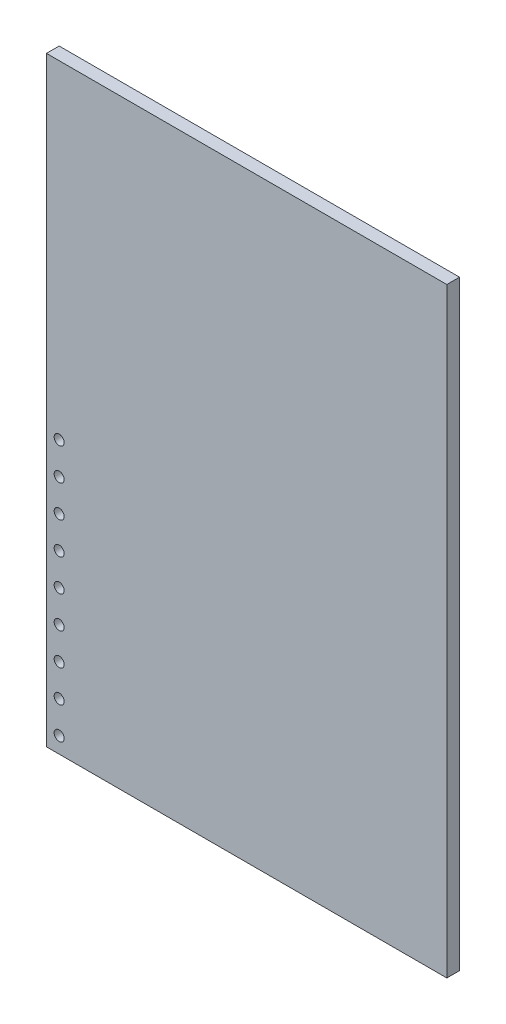
from build123d import *

# Parameters (mm, degrees)
SKETCH1_W           = 100
SKETCH1_H           = 3.175
BOSS_EXTRUDE1_DEPTH = 150
SKETCH2_R           = 1.25
CUT_EXTRUDE2_DEPTH  = 5
SKETCH2_14_R        = 1.25
CUT_EXTRUDE3_DEPTH  = 5
SKETCH2_15_R        = 1.25
CUT_EXTRUDE4_DEPTH  = 5
SKETCH2_16_R        = 1.25
CUT_EXTRUDE5_DEPTH  = 5
SKETCH2_17_R        = 1.25
CUT_EXTRUDE6_DEPTH  = 5
SKETCH2_18_R        = 1.25
CUT_EXTRUDE7_DEPTH  = 5
SKETCH2_19_R        = 1.25
CUT_EXTRUDE8_DEPTH  = 5
SKETCH2_20_R        = 1.25
CUT_EXTRUDE9_DEPTH  = 5
SKETCH2_21_R        = 1.25
CUT_EXTRUDE10_DEPTH = 5


with BuildPart() as part:
    # Sketch1 → Boss-Extrude1 (new body)
    with BuildSketch(Plane(origin=(0, 0, 0), x_dir=(1, 0, 0), z_dir=(0, 1, 0))):
        with Locations((50, 1.5875)):
            Rectangle(SKETCH1_W, SKETCH1_H)
    extrude(amount=BOSS_EXTRUDE1_DEPTH)

    # Sketch2 → Cut-Extrude2 (cut)
    with BuildSketch(Plane.XY):
        with Locations((3.175, 68)):
            Circle(SKETCH2_R)
    extrude(amount=-CUT_EXTRUDE2_DEPTH, mode=Mode.SUBTRACT)

    # Sketch2<14> → Cut-Extrude3 (cut)
    with BuildSketch(Plane.XY):
        with Locations((3.175, 60)):
            Circle(SKETCH2_14_R)
    extrude(amount=-CUT_EXTRUDE3_DEPTH, mode=Mode.SUBTRACT)

    # Sketch2<15> → Cut-Extrude4 (cut)
    with BuildSketch(Plane.XY):
        with Locations((3.175, 52)):
            Circle(SKETCH2_15_R)
    extrude(amount=-CUT_EXTRUDE4_DEPTH, mode=Mode.SUBTRACT)

    # Sketch2<16> → Cut-Extrude5 (cut)
    with BuildSketch(Plane.XY):
        with Locations((3.175, 44)):
            Circle(SKETCH2_16_R)
    extrude(amount=-CUT_EXTRUDE5_DEPTH, mode=Mode.SUBTRACT)

    # Sketch2<17> → Cut-Extrude6 (cut)
    with BuildSketch(Plane.XY):
        with Locations((3.175, 36)):
            Circle(SKETCH2_17_R)
    extrude(amount=-CUT_EXTRUDE6_DEPTH, mode=Mode.SUBTRACT)

    # Sketch2<18> → Cut-Extrude7 (cut)
    with BuildSketch(Plane.XY):
        with Locations((3.175, 28)):
            Circle(SKETCH2_18_R)
    extrude(amount=-CUT_EXTRUDE7_DEPTH, mode=Mode.SUBTRACT)

    # Sketch2<19> → Cut-Extrude8 (cut)
    with BuildSketch(Plane.XY):
        with Locations((3.175, 20)):
            Circle(SKETCH2_19_R)
    extrude(amount=-CUT_EXTRUDE8_DEPTH, mode=Mode.SUBTRACT)

    # Sketch2<20> → Cut-Extrude9 (cut)
    with BuildSketch(Plane.XY):
        with Locations((3.175, 12)):
            Circle(SKETCH2_20_R)
    extrude(amount=-CUT_EXTRUDE9_DEPTH, mode=Mode.SUBTRACT)

    # Sketch2<21> → Cut-Extrude10 (cut)
    with BuildSketch(Plane.XY):
        with Locations((3.175, 4)):
            Circle(SKETCH2_21_R)
    extrude(amount=-CUT_EXTRUDE10_DEPTH, mode=Mode.SUBTRACT)


solid = part.part
